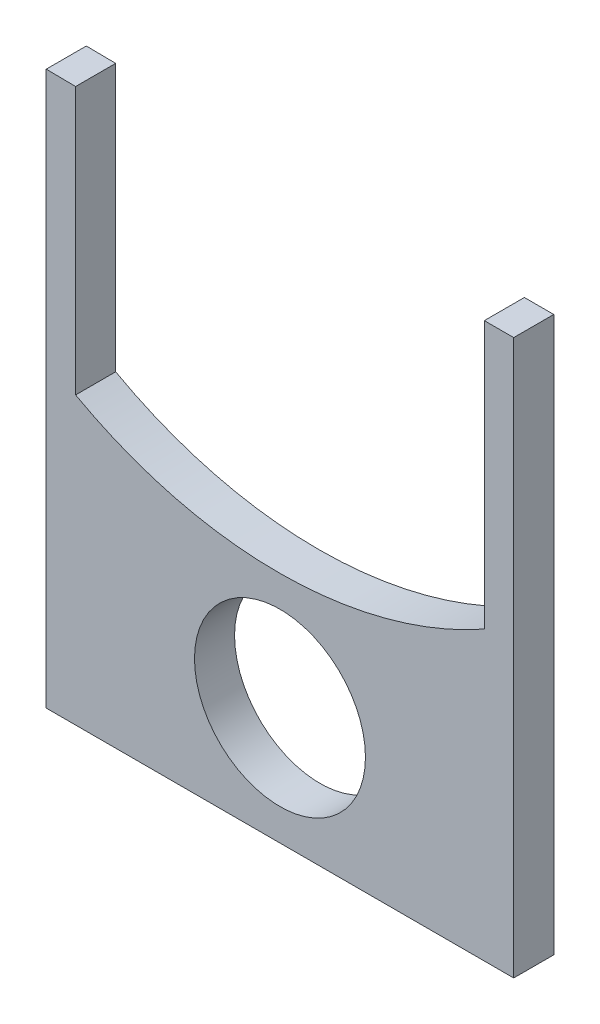
from build123d import *

# Parameters (mm, degrees)
SKETCH1_R           = 6.4
BOSS_EXTRUDE1_DEPTH = 3


with BuildPart() as part:
    # Sketch1 → Boss-Extrude1 (new body)
    with BuildSketch(Plane.XY):
        with BuildLine():
            Line((-17.5, 13.936040182), (-15.300145315, 13.910754496))
            Line((-15.300145315, 13.910754496), (-15.300145315, -6.089245504))
            ThreePointArc((-15.300145315, -6.089245504), (0.015404693, -10.009779787), (15.3, -5.970249195))
            Line((15.3, -5.970249195), (15.3, 14.029750805))
            Line((15.3, 14.029750805), (17.5, 14.029750805))
            Line((17.5, 14.029750805), (17.5, -27.495158637))
            Line((17.5, -27.495158637), (-17.5, -27.495158637))
            Line((-17.5, -27.495158637), (-17.5, 13.936040182))
        make_face()
        with Locations((0, -18.730943454)):
            Circle(SKETCH1_R, mode=Mode.SUBTRACT)
    extrude(amount=BOSS_EXTRUDE1_DEPTH)


solid = part.part
